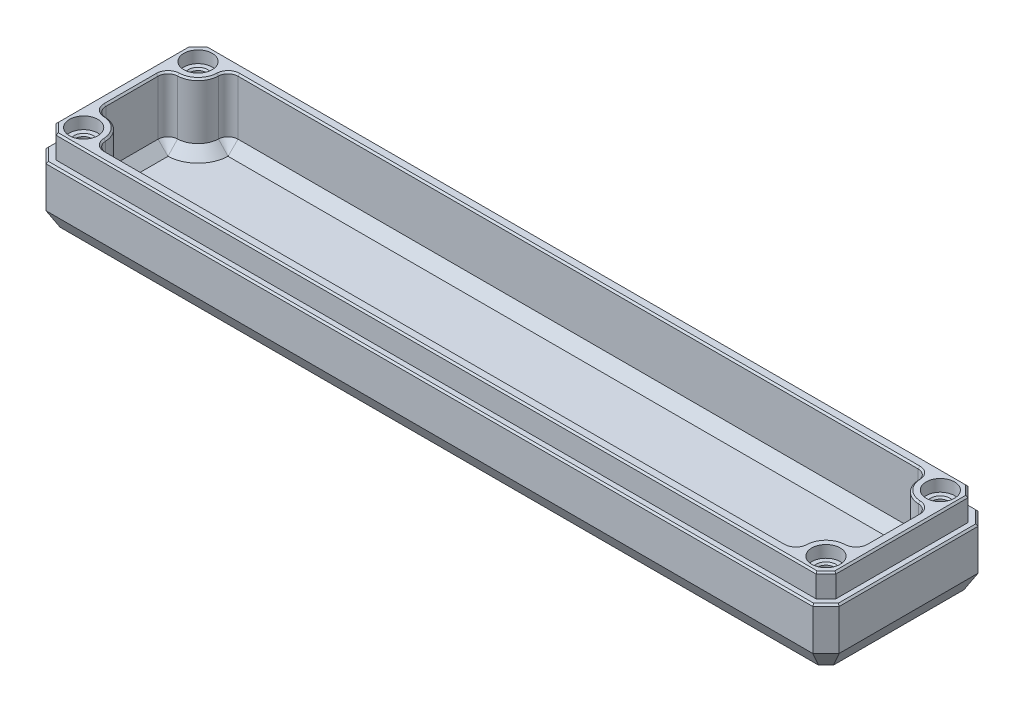
from build123d import *

# Parameters (mm, degrees)
SKETCH1_W             = 240
SKETCH1_H             = 50
BOSS_EXTRUDE1_DEPTH   = 25
SKETCH6_OUTSIDE_W     = 291.284
SKETCH6_OUTSIDE_H     = 101.284
SKETCH6_OUTSIDE_W_2   = 236
SKETCH6_OUTSIDE_H_2   = 46
CUT_EXTRUDE3_DEPTH    = 7
CHAMFER6_SIZE         = 3
CHAMFER5_SIZE         = 4
SKETCH6_9_OUTSIDE_W   = 291.284
SKETCH6_9_OUTSIDE_H   = 101.284
SKETCH6_9_OUTSIDE_W_2 = 236
SKETCH6_9_OUTSIDE_H_2 = 46
SKETCH6_9_OUTSIDE_R   = 4.3
CUT_EXTRUDE5_DEPTH    = 3.6
SKETCH16_R            = 2.45
CUT_EXTRUDE10_DEPTH   = 16
CHAMFER8_SIZE         = 0.5
CHAMFER9_SIZE         = 3
CHAMFER9_SIZE2        = 5.196152423
CHAMFER11_SIZE        = 0.5
CHAMFER12_SIZE        = 0.5
CUT_EXTRUDE11_DEPTH   = 20
CHAMFER13_SIZE        = 0.5
CHAMFER14_SIZE        = 3


with BuildPart() as part:
    # Sketch1 → Boss-Extrude1 (new body)
    with BuildSketch(Plane(origin=(0, 0, 0), x_dir=(1, 0, 0), z_dir=(0, 1, 0))):
        with Locations((115, 20)):
            Rectangle(SKETCH1_W, SKETCH1_H)
    extrude(amount=-BOSS_EXTRUDE1_DEPTH)

    # Sketch6 outside → Cut-Extrude3 (cut)
    with BuildSketch(Plane(origin=(0, 0, 0), x_dir=(1, 0, 0), z_dir=(0, 1, 0))):
        with Locations((115, 20)):
            Rectangle(SKETCH6_OUTSIDE_W, SKETCH6_OUTSIDE_H)
        with Locations((115, 20)):
            Rectangle(SKETCH6_OUTSIDE_W_2, SKETCH6_OUTSIDE_H_2, mode=Mode.SUBTRACT)
    extrude(amount=-CUT_EXTRUDE3_DEPTH, mode=Mode.SUBTRACT)

    # Chamfer6
    chamfer6_edges = [part.edges().sort_by_distance(p)[0] for p in [
        (-3, -3.5, -43),
        (233, -3.5, -43),
        (233, -3.5, 3),
        (-3, -3.5, 3),
    ]]
    chamfer(chamfer6_edges, length=CHAMFER6_SIZE)

    # Chamfer5
    chamfer5_edges = [part.edges().sort_by_distance(p)[0] for p in [
        (-5, -16, 5),
        (-5, -16, -45),
        (235, -16, -45),
        (235, -16, 5),
    ]]
    chamfer(chamfer5_edges, length=CHAMFER5_SIZE)

    # Sketch6<9> outside → Cut-Extrude5 (cut)
    # profile 1 of 5: a face of its own
    with BuildSketch(Plane(origin=(0, 0, 0), x_dir=(1, 0, 0), z_dir=(0, 1, 0))):
        with Locations((115, 20)):
            Rectangle(SKETCH6_9_OUTSIDE_W, SKETCH6_9_OUTSIDE_H)
        with Locations((115, 20)):
            Rectangle(SKETCH6_9_OUTSIDE_W_2, SKETCH6_9_OUTSIDE_H_2, mode=Mode.SUBTRACT)
    # profile 2 of 5: a face of its own
    with BuildSketch(Plane(origin=(0, 0, 0), x_dir=(1, 0, 0), z_dir=(0, 1, 0))):
        with Locations(Location((2.7, 37.3, 0), (0, 0, 270))):
            Circle(SKETCH6_9_OUTSIDE_R)
    # profile 3 of 5: a face of its own
    with BuildSketch(Plane(origin=(0, 0, 0), x_dir=(1, 0, 0), z_dir=(0, 1, 0))):
        with Locations(Location((227.3, 37.3, 0), (0, 0, 270))):
            Circle(SKETCH6_9_OUTSIDE_R)
    # profile 4 of 5: a face of its own
    with BuildSketch(Plane(origin=(0, 0, 0), x_dir=(1, 0, 0), z_dir=(0, 1, 0))):
        with Locations(Location((227.3, 2.7, 0), (0, 0, 270))):
            Circle(SKETCH6_9_OUTSIDE_R)
    # profile 5 of 5: a face of its own
    with BuildSketch(Plane(origin=(0, 0, 0), x_dir=(1, 0, 0), z_dir=(0, 1, 0))):
        with Locations(Location((2.7, 2.7, 0), (0, 0, 270))):
            Circle(SKETCH6_9_OUTSIDE_R)
    extrude(amount=-CUT_EXTRUDE5_DEPTH, mode=Mode.SUBTRACT)

    # Sketch16 → Cut-Extrude10 (cut)
    with BuildSketch(Plane(origin=(0, -3.6, 0), x_dir=(1, 0, 0), z_dir=(0, 1, 0))):
        with Locations(Location((2.7, 2.7, 0), (0, 0, 270))):
            Circle(SKETCH16_R)
        with Locations(Location((2.7, 37.3, 0), (0, 0, 270))):
            Circle(SKETCH16_R)
        with Locations(Location((227.3, 37.3, 0), (0, 0, 270))):
            Circle(SKETCH16_R)
        with Locations(Location((227.3, 2.7, 0), (0, 0, 270))):
            Circle(SKETCH16_R)
    extrude(amount=-CUT_EXTRUDE10_DEPTH, mode=Mode.SUBTRACT)

    # Chamfer8
    chamfer8_edges = [part.edges().sort_by_distance(p)[0] for p in [
        (227.3, -3.6, -5.15),
        (227.3, -3.6, -39.75),
        (2.7, -3.6, -39.75),
        (2.7, -3.6, -5.15),
    ]]
    chamfer(chamfer8_edges, length=CHAMFER8_SIZE)

    # Chamfer9
    chamfer9_edges = [part.edges().sort_by_distance(p)[0] for p in [
        (115, -25, -45),
        (-5, -25, -20),
        (115, -25, 5),
        (235, -25, -20),
        (233, -25, -43),
        (233, -25, 3),
        (-3, -25, 3),
        (-3, -25, -43),
    ]]
    chamfer9_side = [part.faces().sort_by_distance(p)[0] for p in [
        (115, -25, -20),
    ]]
    chamfer(chamfer9_edges, length=CHAMFER9_SIZE, length2=CHAMFER9_SIZE2, reference=chamfer9_side[0])

    # Chamfer11
    chamfer11_edges = [part.edges().sort_by_distance(p)[0] for p in [
        (115, 0, 3),
        (-3, 0, -20),
        (233, 0, -20),
        (115, 0, -43),
        (-1.5, 0, 1.5),
        (-1.5, 0, -41.5),
        (231.5, 0, -41.5),
        (231.5, 0, 1.5),
    ]]
    chamfer(chamfer11_edges, length=CHAMFER11_SIZE)

    # Chamfer12
    chamfer12_edges = [part.edges().sort_by_distance(p)[0] for p in [
        (115, -7, -45),
        (115, -7, 5),
        (235, -7, -20),
        (-5, -7, -20),
        (233, -7, -43),
        (233, -7, 3),
        (-3, -7, 3),
        (-3, -7, -43),
    ]]
    chamfer(chamfer12_edges, length=CHAMFER12_SIZE)

    # Sketch18 → Cut-Extrude11 (cut)
    with BuildSketch(Plane(origin=(0, 0, 0), x_dir=(1, 0, 0), z_dir=(0, 1, 0))):
        with BuildLine():
            Line((230, 12.092866172), (230, 27.907133828))
            ThreePointArc((230, 27.907133828), (229.154913652, 29.994320249), (227.095768564, 30.905604835))
            ThreePointArc((227.095768564, 30.905604835), (222.776174185, 32.776174185), (220.905604835, 37.095768564))
            ThreePointArc((220.905604835, 37.095768564), (219.994320249, 39.154913652), (217.907133828, 40))
            Line((217.907133828, 40), (12.092866172, 40))
            ThreePointArc((12.092866172, 40), (10.005679751, 39.154913652), (9.094395165, 37.095768564))
            ThreePointArc((9.094395165, 37.095768564), (7.223825815, 32.776174185), (2.904231436, 30.905604835))
            ThreePointArc((2.904231436, 30.905604835), (0.845086348, 29.994320249), (0, 27.907133828))
            Line((0, 27.907133828), (0, 12.092866172))
            ThreePointArc((0, 12.092866172), (0.845086348, 10.005679751), (2.904231436, 9.094395165))
            ThreePointArc((2.904231436, 9.094395165), (7.223825815, 7.223825815), (9.094395165, 2.904231436))
            ThreePointArc((9.094395165, 2.904231436), (10.005679751, 0.845086348), (12.092866172, 0))
            Line((12.092866172, 0), (217.907133828, 0))
            ThreePointArc((217.907133828, 0), (219.994320249, 0.845086348), (220.905604835, 2.904231436))
            ThreePointArc((220.905604835, 2.904231436), (222.776174185, 7.223825815), (227.095768564, 9.094395165))
            ThreePointArc((227.095768564, 9.094395165), (229.154913652, 10.005679751), (230, 12.092866172))
        make_face()
    extrude(amount=-CUT_EXTRUDE11_DEPTH, mode=Mode.SUBTRACT)

    # Chamfer13
    chamfer13_edges = [part.edges().sort_by_distance(p)[0] for p in [
        (229.154913652, 0, -29.994320249),
        (222.776174185, 0, -32.776174185),
        (219.994320249, 0, -39.154913652),
        (115, 0, -40),
        (10.005679751, 0, -39.154913652),
        (7.223825815, 0, -32.776174185),
        (0.845086348, 0, -29.994320249),
        (0, 0, -20),
        (0.845086348, 0, -10.005679751),
        (7.223825815, 0, -7.223825815),
        (10.005679751, 0, -0.845086348),
        (115, 0, 0),
        (219.994320249, 0, -0.845086348),
        (222.776174185, 0, -7.223825815),
        (229.154913652, 0, -10.005679751),
        (230, 0, -20),
    ]]
    chamfer(chamfer13_edges, length=CHAMFER13_SIZE)

    # Chamfer14
    chamfer14_edges = [part.edges().sort_by_distance(p)[0] for p in [
        (222.776174185, -20, -32.776174185),
        (219.994320249, -20, -39.154913652),
        (115, -20, -40),
        (10.005679751, -20, -39.154913652),
        (7.223825815, -20, -32.776174185),
        (0.845086348, -20, -29.994320249),
        (0, -20, -20),
        (0.845086348, -20, -10.005679751),
        (7.223825815, -20, -7.223825815),
        (10.005679751, -20, -0.845086348),
        (115, -20, 0),
        (219.994320249, -20, -0.845086348),
        (222.776174185, -20, -7.223825815),
        (229.154913652, -20, -10.005679751),
        (230, -20, -20),
        (229.154913652, -20, -29.994320249),
    ]]
    chamfer(chamfer14_edges, length=CHAMFER14_SIZE - 0.0001)  # a hair under: the kernel refuses the full size


solid = part.part
